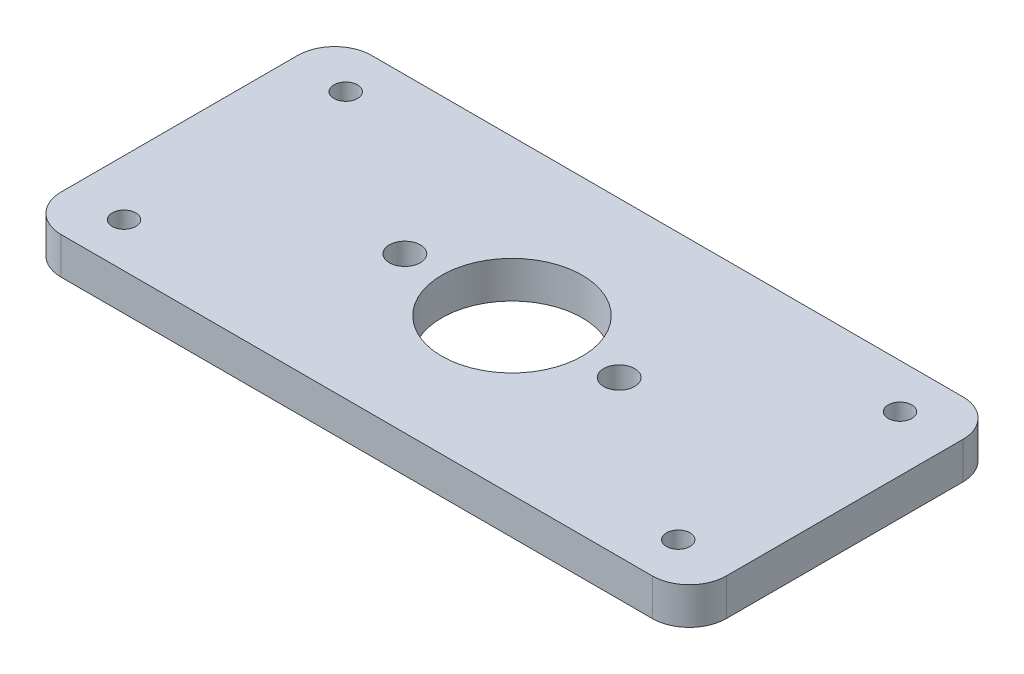
from build123d import *

# Parameters (mm, degrees)
SKETCH1_W           = 90
SKETCH1_H           = 42
SKETCH1_R           = 9.5
SKETCH1_R_2         = 2.1
SKETCH1_R_3         = 1.6
BOSS_EXTRUDE1_DEPTH = 5
FILLET1_R           = 5


with BuildPart() as part:
    # Sketch1 → Boss-Extrude1 (new body)
    with BuildSketch(Plane(origin=(0, 0, 0), x_dir=(1, 0, 0), z_dir=(0, 1, 0))):
        with Locations((45, 21)):
            Rectangle(SKETCH1_W, SKETCH1_H)
        with Locations((45, 21)):
            Circle(SKETCH1_R, mode=Mode.SUBTRACT)
        with Locations((59.5, 21)):
            Circle(SKETCH1_R_2, mode=Mode.SUBTRACT)
        with Locations((30.5, 21)):
            Circle(SKETCH1_R_2, mode=Mode.SUBTRACT)
        with Locations((7.5, 36)):
            Circle(SKETCH1_R_3, mode=Mode.SUBTRACT)
        with Locations((7.5, 6)):
            Circle(SKETCH1_R_3, mode=Mode.SUBTRACT)
        with Locations((82.5, 6)):
            Circle(SKETCH1_R_3, mode=Mode.SUBTRACT)
        with Locations((82.5, 36)):
            Circle(SKETCH1_R_3, mode=Mode.SUBTRACT)
    extrude(amount=BOSS_EXTRUDE1_DEPTH)

    # Fillet1
    fillet1_edges = [part.edges().sort_by_distance(p)[0] for p in [
        (90, 2.5, -42),
        (90, 2.5, 0),
        (0, 2.5, 0),
        (0, 2.5, -42),
    ]]
    fillet(fillet1_edges, radius=FILLET1_R)


solid = part.part
